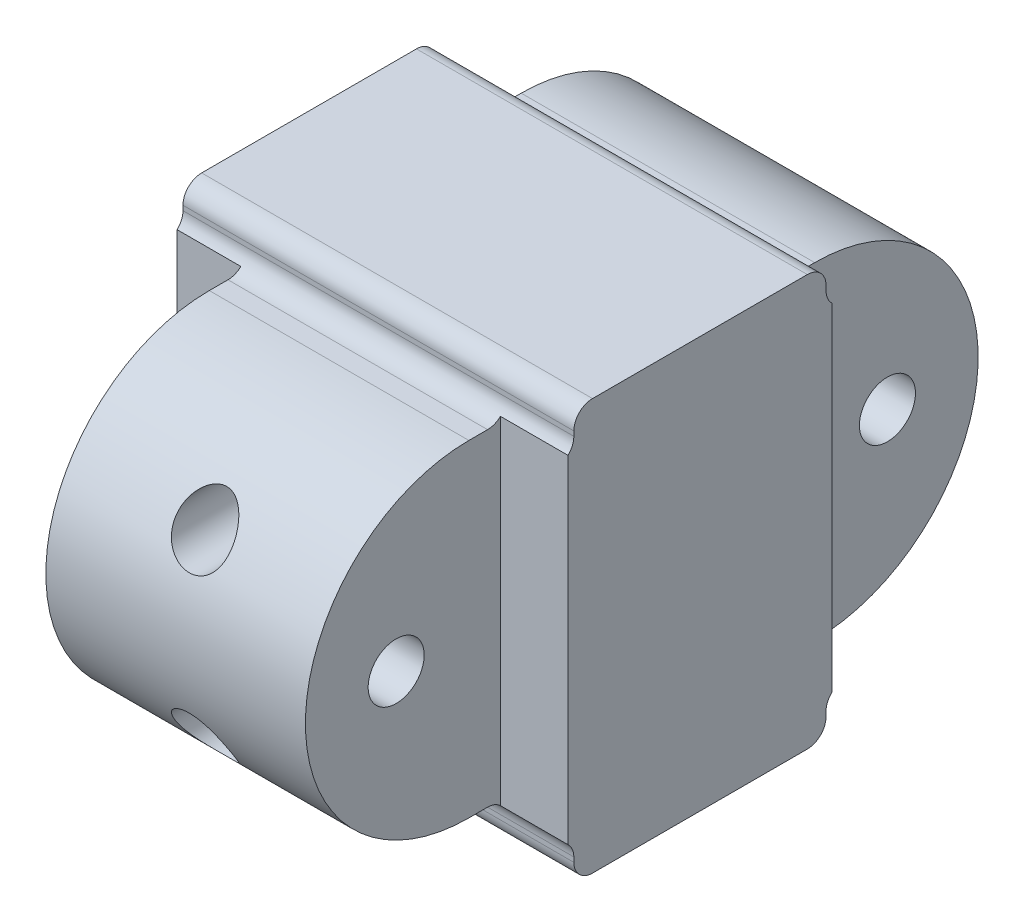
from build123d import *

# Parameters (mm, degrees)
SKETCH2_W           = 20.922356035
SKETCH2_H           = 22
BOSS_EXTRUDE1_DEPTH = 35
SKETCH3_R           = 1.5
CUT_EXTRUDE1_DEPTH  = 31
SKETCH7_W           = 2
SKETCH7_H           = 2.25
CUT_EXTRUDE3_DEPTH  = 22
SKETCH8_W           = 2
SKETCH8_H           = 2.25
CUT_EXTRUDE4_DEPTH  = 22
SKETCH11_R          = 1.5
SKETCH11_W          = 2.606017342
SKETCH11_H          = 18.048523845
SKETCH11_W_2        = 2.606017343
CUT_EXTRUDE5_DEPTH  = 36
FILLET2_R           = 1
BOSS_EXTRUDE2_REACH = 95.223
SKETCH12_W          = 2.606017343
SKETCH12_H          = 14.124057788
SKETCH12_W_2        = 2.606017342
CUT_EXTRUDE6_REACH  = 54.468
SKETCH13_W          = 3.309729442
SKETCH13_H          = 19.459110601
SKETCH13_W_2        = 3.249965826
SKETCH13_H_2        = 19.123541834


with BuildPart() as part:
    # Sketch2 → Boss-Extrude1 (new body)
    with BuildSketch(Plane(origin=(0, 0, 53.835350067), x_dir=(-1, 0, 0), z_dir=(0, 0, -1))):
        with Locations((9.484421134, 16.479237668)):
            Rectangle(SKETCH2_W, SKETCH2_H)
    extrude(amount=-BOSS_EXTRUDE1_DEPTH)

    # Sketch3 → Cut-Extrude1 (cut)
    with BuildSketch(Plane.ZY.offset(19.945599152)):
        with Locations((58.692130127, 16.479237668)):
            Circle(SKETCH3_R)
        with Locations((83.978570007, 16.479237668)):
            Circle(SKETCH3_R)
        with BuildLine():
            Line((62.585350067, 25.229237668), (62.585350067, 27.479237668))
            add(Edge.make_bspline(
                [(62.585350067, 5.479237668), (55.503237571, -7.59972181), (27.642884441, 16.75686213), (54.847177094, 35.965561503), (62.585350067, 27.479237668)],
                knots=[0, 0, 0, 0, 0.52323238, 1, 1, 1, 1], degree=3))
            Line((62.585350067, 5.479237668), (62.585350067, 7.729237668))
            ThreePointArc((62.585350067, 7.729237668), (56.398165732, 10.292053333), (53.835350067, 16.479237668))
            ThreePointArc((53.835350067, 16.479237668), (56.398165732, 22.666422004), (62.585350067, 25.229237668))
        make_face()
        with BuildLine():
            Line((80.085350067, 25.229237668), (80.085350067, 27.479237668))
            add(Edge.make_bspline(
                [(80.085350067, 5.479237668), (87.439945262, -7.310081119), (114.923859956, 16.481856124), (87.400752328, 40.475015582), (80.085350067, 27.479237668)],
                knots=[0, 0, 0, 0, 0.498892453, 1, 1, 1, 1], degree=3))
            Line((80.085350067, 5.479237668), (80.085350067, 7.729237668))
            ThreePointArc((80.085350067, 7.729237668), (86.272534402, 10.292053333), (88.835350067, 16.479237668))
            ThreePointArc((88.835350067, 16.479237668), (86.272534402, 22.666422004), (80.085350067, 25.229237668))
        make_face()
    extrude(amount=-CUT_EXTRUDE1_DEPTH, mode=Mode.SUBTRACT)

    # Sketch7 → Cut-Extrude3 (cut)
    with BuildSketch(Plane.ZY.offset(19.945599152)):
        with Locations((63.585350067, 26.354237668)):
            Rectangle(SKETCH7_W, SKETCH7_H)
        with Locations((79.085350067, 26.354237668)):
            Rectangle(SKETCH7_W, SKETCH7_H)
    extrude(amount=-CUT_EXTRUDE3_DEPTH, mode=Mode.SUBTRACT)

    # Sketch8 → Cut-Extrude4 (cut)
    with BuildSketch(Plane.ZY.offset(19.945599152)):
        with Locations((63.585350067, 6.604237668)):
            Rectangle(SKETCH8_W, SKETCH8_H)
        with Locations((79.085350067, 6.604237668)):
            Rectangle(SKETCH8_W, SKETCH8_H)
    extrude(amount=-CUT_EXTRUDE4_DEPTH, mode=Mode.SUBTRACT)

    # Sketch11 → Cut-Extrude5 (cut)
    with BuildSketch(Plane(origin=(0, 0, 53.835350067), x_dir=(-1, 0, 0), z_dir=(0, 0, -1))):
        with Locations(Location((9.484421134, 11.729237668, 0), (0, 0, 90))):
            Circle(SKETCH11_R)
        with Locations(Location((9.484421134, 21.23419775, 0), (0, 0, 90))):
            Circle(SKETCH11_R)
        with Locations((0.326251788, 16.479237669)):
            Rectangle(SKETCH11_W, SKETCH11_H)
        with Locations((18.642590481, 16.479237669)):
            Rectangle(SKETCH11_W_2, SKETCH11_H)
    extrude(amount=-CUT_EXTRUDE5_DEPTH, mode=Mode.SUBTRACT)

    # Fillet2
    fillet2_edges = [part.edges().sort_by_distance(p)[0] for p in [
        (-9.484421134, 27.479237668, 78.085350067),
    ]]
    fillet(fillet2_edges, radius=FILLET2_R)
    fillet2_2_edges = [part.edges().sort_by_distance(p)[0] for p in [
        (-9.484421134, 27.479237668, 64.585350067),
    ]]
    fillet(fillet2_2_edges, radius=FILLET2_R)
    fillet2_3_edges = [part.edges().sort_by_distance(p)[0] for p in [
        (-9.484421134, 7.729237668, 64.585350067),
    ]]
    fillet(fillet2_3_edges, radius=FILLET2_R)
    fillet2_4_edges = [part.edges().sort_by_distance(p)[0] for p in [
        (-9.484421134, 25.229237668, 64.585350067),
    ]]
    fillet(fillet2_4_edges, radius=FILLET2_R)
    fillet2_5_edges = [part.edges().sort_by_distance(p)[0] for p in [
        (-9.484421134, 25.229237668, 78.085350067),
    ]]
    fillet(fillet2_5_edges, radius=FILLET2_R)
    fillet2_6_edges = [part.edges().sort_by_distance(p)[0] for p in [
        (-9.484421134, 7.729237668, 78.085350067),
    ]]
    fillet(fillet2_6_edges, radius=FILLET2_R)
    fillet2_7_edges = [part.edges().sort_by_distance(p)[0] for p in [
        (-9.484421134, 5.479237668, 78.085350067),
    ]]
    fillet(fillet2_7_edges, radius=FILLET2_R)
    fillet2_8_edges = [part.edges().sort_by_distance(p)[0] for p in [
        (-9.484421134, 5.479237668, 64.585350067),
    ]]
    fillet(fillet2_8_edges, radius=FILLET2_R)

    # Boss-Extrude2: up to this face of the body (flat: up to its plane)
    boss_extrude2_end = Plane(part.part.faces().sort_by_distance((-18.642590481, 7.454975746, 71.335350067))[0])
    # Sketch12 → Boss-Extrude2 (add, up to the picked face)
    with BuildSketch(Plane.XZ.offset(-25.503499591), mode=Mode.PRIVATE) as boss_extrude2_sk1:
        with Locations((-18.642590481, 71.335350067)):
            Rectangle(SKETCH12_W, SKETCH12_H)
    boss_extrude2_tool1 = split(extrude(boss_extrude2_sk1.sketch, amount=BOSS_EXTRUDE2_REACH, mode=Mode.PRIVATE), bisect_by=boss_extrude2_end, keep=Keep.BOTH, mode=Mode.PRIVATE)
    # Sketch12 → Boss-Extrude2 (add, up to the picked face)
    with BuildSketch(Plane.XZ.offset(-25.503499591), mode=Mode.PRIVATE) as boss_extrude2_sk2:
        with Locations((-0.326251788, 71.335350067)):
            Rectangle(SKETCH12_W_2, SKETCH12_H)
    boss_extrude2_tool2 = split(extrude(boss_extrude2_sk2.sketch, amount=BOSS_EXTRUDE2_REACH, mode=Mode.PRIVATE), bisect_by=boss_extrude2_end, keep=Keep.BOTH, mode=Mode.PRIVATE)
    add(boss_extrude2_tool1.solids().sort_by(Axis((-18.64259, 25.5035, 71.33535), (0, -1, 0)))[0])
    add(boss_extrude2_tool2.solids().sort_by(Axis((-0.326252, 25.5035, 71.33535), (0, -1, 0)))[0])

    # Cut-Extrude6: up to this face of the body (flat: up to its plane)
    cut_extrude6_end = Plane(part.part.faces().sort_by_distance((-0.326251788, 16.479237668, 78.397378961))[0])
    # Sketch13 → Cut-Extrude6 (cut, up to the picked face)
    with BuildSketch(Plane(origin=(0, 0, 93.835350067), x_dir=(-1, 0, 0), z_dir=(0, 0, -1)), mode=Mode.PRIVATE) as cut_extrude6_sk1:
        with Locations((18.191565455, 16.712143076)):
            Rectangle(SKETCH13_W, SKETCH13_H)
    cut_extrude6_tool1 = split(extrude(cut_extrude6_sk1.sketch, amount=CUT_EXTRUDE6_REACH, mode=Mode.PRIVATE), bisect_by=cut_extrude6_end, keep=Keep.BOTH, mode=Mode.PRIVATE)
    # Sketch13 → Cut-Extrude6 (cut, up to the picked face)
    with BuildSketch(Plane(origin=(0, 0, 93.835350067), x_dir=(-1, 0, 0), z_dir=(0, 0, -1)), mode=Mode.PRIVATE) as cut_extrude6_sk2:
        with Locations((1.015942541, 16.59296095)):
            Rectangle(SKETCH13_W_2, SKETCH13_H_2)
    cut_extrude6_tool2 = split(extrude(cut_extrude6_sk2.sketch, amount=CUT_EXTRUDE6_REACH, mode=Mode.PRIVATE), bisect_by=cut_extrude6_end, keep=Keep.BOTH, mode=Mode.PRIVATE)
    add(cut_extrude6_tool1.solids().sort_by(Axis((-18.191565, 16.712143, 93.83535), (0, 0, -1)))[0], mode=Mode.SUBTRACT)
    add(cut_extrude6_tool2.solids().sort_by(Axis((-1.015943, 16.592961, 93.83535), (0, 0, -1)))[0], mode=Mode.SUBTRACT)


solid = part.part
